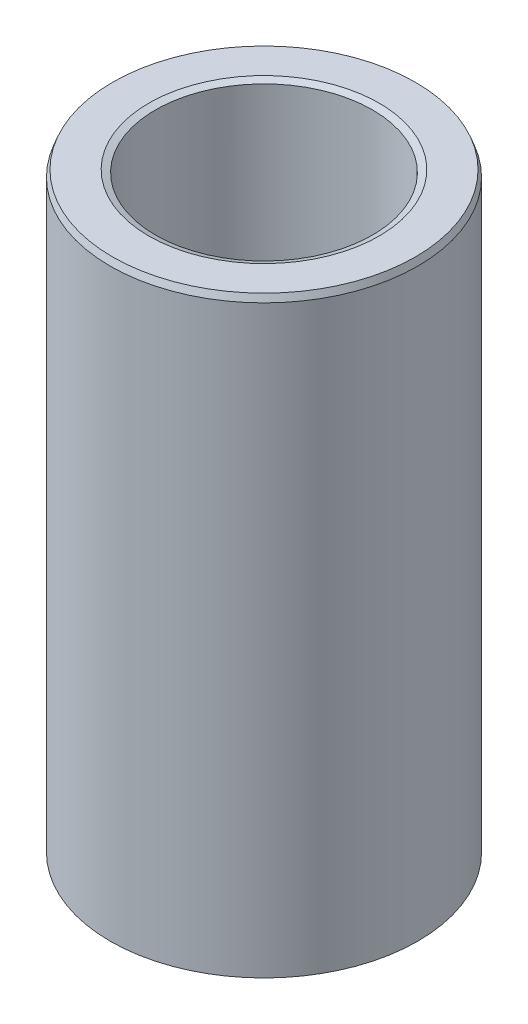
from build123d import *
from OCP.BRepFilletAPI import BRepFilletAPI_MakeChamfer

# Parameters (mm, degrees)
SKETCH1_R           = 35
BOSS_EXTRUDE1_DEPTH = 135.089937448
SKETCH2_R           = 24.682125786
CUT_EXTRUDE1_DEPTH  = 144.872482427
CHAMFER1_SIZE       = 1.518689229
CHAMFER1_SIZE2      = 0.566540213


with BuildPart() as part:
    # Sketch1 → Boss-Extrude1 (new body)
    with BuildSketch(Plane(origin=(0, 0, 0), x_dir=(1, 0, 0), z_dir=(0, 1, 0))):
        Circle(SKETCH1_R)
    extrude(amount=BOSS_EXTRUDE1_DEPTH)

    # Sketch2 → Cut-Extrude1 (cut, through all)
    with BuildSketch(Plane(origin=(0, 0, 0), x_dir=(1, 0, 0), z_dir=(0, 1, 0))):
        Circle(SKETCH2_R)
    extrude(amount=CUT_EXTRUDE1_DEPTH, mode=Mode.SUBTRACT)

    # Chamfer1: one chamfer whose edges measure the first distance from different faces: ONE call of the kernel's chamfer builder (chamfer() names one face for all edges)
    chamfer1_edges_1 = [part.edges().sort_by_distance(p)[0] for p in [
        (-24.682125786, 135.089937448, 0),
    ]]
    chamfer1_side_1 = [part.faces().sort_by_distance(p)[0] for p in [
        (-34.010050506, 135.089937448, 0),
    ]]
    chamfer1_edges_2 = [part.edges().sort_by_distance(p)[0] for p in [
        (-24.682125786, 0, 0),
    ]]
    chamfer1_side_2 = [part.faces().sort_by_distance(p)[0] for p in [
        (-24.682125786, 67.544968724, 0),
    ]]
    chamfer1_edges_3 = [part.edges().sort_by_distance(p)[0] for p in [
        (-35, 0, 0),
    ]]
    chamfer1_side_3 = [part.faces().sort_by_distance(p)[0] for p in [
        (-34.010050506, 0, 0),
    ]]
    chamfer1_edges_4 = [part.edges().sort_by_distance(p)[0] for p in [
        (-35, 135.089937448, 0),
    ]]
    chamfer1_side_4 = [part.faces().sort_by_distance(p)[0] for p in [
        (-35, 67.544968724, 0),
    ]]
    chamfer1 = BRepFilletAPI_MakeChamfer(part.part.solid().wrapped)
    for e in chamfer1_edges_1:
        chamfer1.Add(CHAMFER1_SIZE, CHAMFER1_SIZE2, e.wrapped, chamfer1_side_1[0].wrapped)  # the first distance lies on this face
    for e in chamfer1_edges_2:
        chamfer1.Add(CHAMFER1_SIZE, CHAMFER1_SIZE2, e.wrapped, chamfer1_side_2[0].wrapped)  # the first distance lies on this face
    for e in chamfer1_edges_3:
        chamfer1.Add(CHAMFER1_SIZE, CHAMFER1_SIZE2, e.wrapped, chamfer1_side_3[0].wrapped)  # the first distance lies on this face
    for e in chamfer1_edges_4:
        chamfer1.Add(CHAMFER1_SIZE, CHAMFER1_SIZE2, e.wrapped, chamfer1_side_4[0].wrapped)  # the first distance lies on this face
    add(Compound.cast(chamfer1.Shape()), mode=Mode.REPLACE)


solid = part.part
